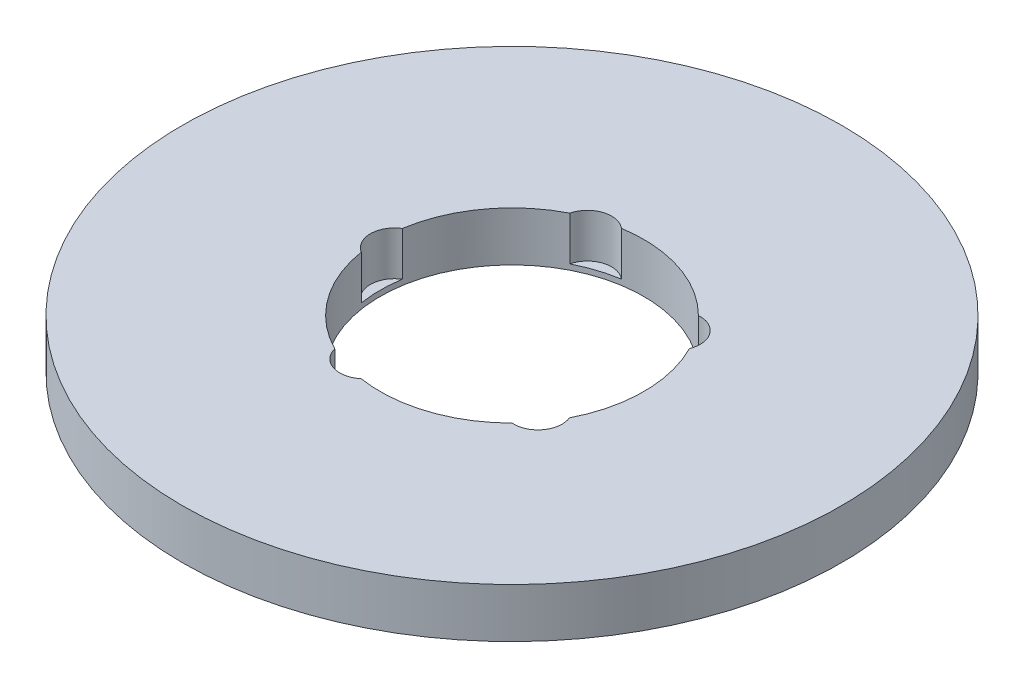
from build123d import *

# Parameters (mm, degrees)
SKETCH1_R           = 100
BOSS_EXTRUDE1_DEPTH = 15
SKETCH2_R           = 40
CUT_EXTRUDE1_DEPTH  = 143.214626533
SKETCH3_R           = 7.316533745
CUT_EXTRUDE2_DEPTH  = 13.341608278
CIRPATTERN1_COUNT   = 5


with BuildPart() as part:
    # Sketch1 → Boss-Extrude1 (new body)
    with BuildSketch(Plane(origin=(0, 0, 0), x_dir=(1, 0, 0), z_dir=(0, 1, 0))):
        Circle(SKETCH1_R)
    extrude(amount=BOSS_EXTRUDE1_DEPTH)

    # Sketch2 → Cut-Extrude1 (cut, through all)
    with BuildSketch(Plane(origin=(0, 0, 0), x_dir=(1, 0, 0), z_dir=(0, 1, 0))):
        Circle(SKETCH2_R)
    extrude(amount=CUT_EXTRUDE1_DEPTH, mode=Mode.SUBTRACT)

    # Sketch3 → Cut-Extrude2 (cut)
    with BuildSketch(Plane(origin=(0, 15, 0), x_dir=(1, 0, 0), z_dir=(0, 1, 0))):
        with Locations((-35.656667044, 0)):
            Circle(SKETCH3_R)
    cut_extrude2 = extrude(amount=-CUT_EXTRUDE2_DEPTH, mode=Mode.SUBTRACT)

    # CirPattern1: Cut-Extrude2 ×5 about axis
    cirpattern1_axis = Axis((0, 0, 0), (0, 1, 0))
    for i in range(1, CIRPATTERN1_COUNT):
        add(cut_extrude2.rotate(cirpattern1_axis, i * 360 / CIRPATTERN1_COUNT), mode=Mode.SUBTRACT)


solid = part.part
